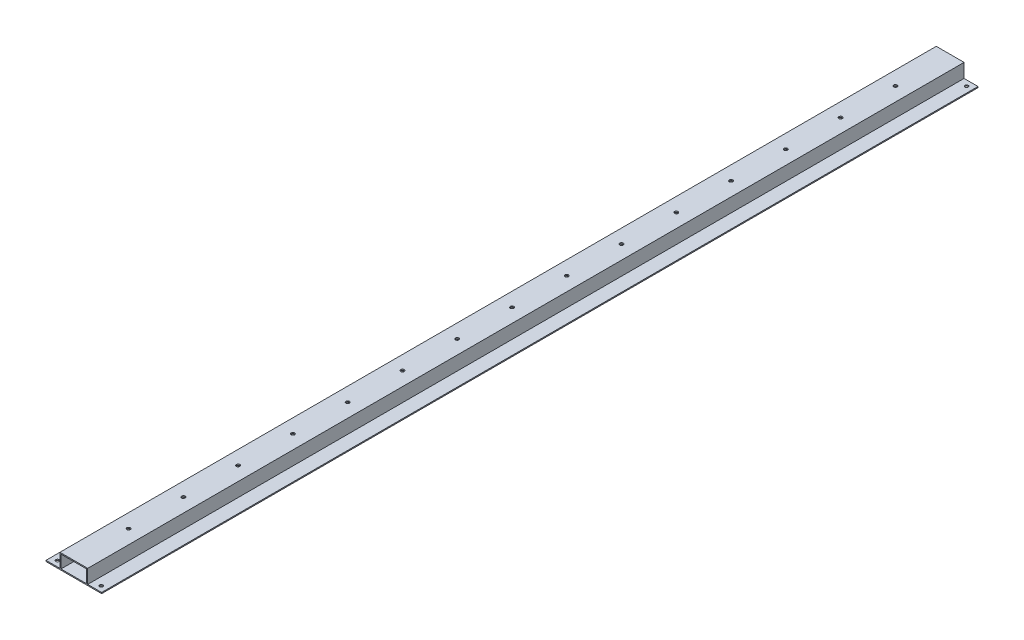
from build123d import *

# Parameters (mm, degrees)
SALIENTE_EXTRUIR1_DEPTH = 400
CROQUIS2_R              = 1.5
CORTAR_EXTRUIR1_DEPTH   = 10
CROQUIS3_R              = 1.5875
CORTAR_EXTRUIR2_DEPTH   = 402.039711251


with BuildPart() as part:
    # Croquis1 → Saliente-Extruir1 (new, symmetric)
    with BuildSketch(Plane.XY):
        Polygon((12.7, 13.7), (0, 13.7), (-12.7, 13.7), (-12.7, 1), (-25.4, 1), (-25.4, 0), (25.4, 0), (25.4, 1), (12.7, 1), align=None)
        Polygon((-11.7, 12.7), (0, 12.7), (11.7, 12.7), (11.7, 1), (-11.7, 1), align=None, mode=Mode.SUBTRACT)
    extrude(amount=SALIENTE_EXTRUIR1_DEPTH, both=True)

    # Croquis2 → Cortar-Extruir1 (cut)
    with BuildSketch(Plane.XZ):
        with Locations((-20, 395)):
            Circle(CROQUIS2_R)
        with Locations((20, 395)):
            Circle(CROQUIS2_R)
        with Locations((20, -395)):
            Circle(CROQUIS2_R)
        with Locations((-20, -395)):
            Circle(CROQUIS2_R)
    extrude(amount=-CORTAR_EXTRUIR1_DEPTH, mode=Mode.SUBTRACT)

    # Croquis3 → Cortar-Extruir2 (cut, through all)
    with BuildSketch(Plane.XZ):
        Circle(CROQUIS3_R)
        with Locations((0, 50)):
            Circle(CROQUIS3_R)
        with Locations((0, 100)):
            Circle(CROQUIS3_R)
        with Locations((0, 150)):
            Circle(CROQUIS3_R)
        with Locations((0, 200)):
            Circle(CROQUIS3_R)
        with Locations((0, 250)):
            Circle(CROQUIS3_R)
        with Locations((0, 300)):
            Circle(CROQUIS3_R)
        with Locations((0, 350)):
            Circle(CROQUIS3_R)
        with Locations((0, -50)):
            Circle(CROQUIS3_R)
        with Locations((0, -100)):
            Circle(CROQUIS3_R)
        with Locations((0, -150)):
            Circle(CROQUIS3_R)
        with Locations((0, -200)):
            Circle(CROQUIS3_R)
        with Locations((0, -250)):
            Circle(CROQUIS3_R)
        with Locations((0, -300)):
            Circle(CROQUIS3_R)
        with Locations((0, -350)):
            Circle(CROQUIS3_R)
    extrude(amount=-CORTAR_EXTRUIR2_DEPTH, mode=Mode.SUBTRACT)


solid = part.part
